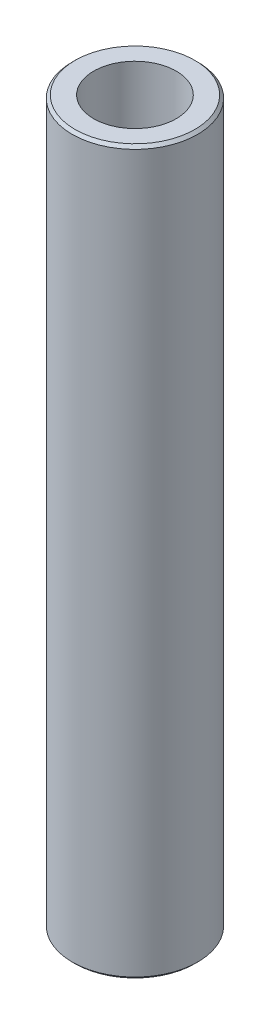
from build123d import *

# Parameters (mm, degrees)
SKETCH1_R           = 15
BOSS_EXTRUDE1_DEPTH = 172.743536967
SKETCH2_R           = 9.87025809
CUT_EXTRUDE1_DEPTH  = 175.041172037
CHAMFER1_SIZE       = 0.676382154


with BuildPart() as part:
    # Sketch1 → Boss-Extrude1 (new body)
    with BuildSketch(Plane(origin=(0, 0, 0), x_dir=(1, 0, 0), z_dir=(0, 1, 0))):
        Circle(SKETCH1_R)
    extrude(amount=BOSS_EXTRUDE1_DEPTH)

    # Sketch2 → Cut-Extrude1 (cut, through all)
    with BuildSketch(Plane(origin=(0, 0, 0), x_dir=(1, 0, 0), z_dir=(0, 1, 0))):
        Circle(SKETCH2_R)
    extrude(amount=CUT_EXTRUDE1_DEPTH, mode=Mode.SUBTRACT)

    # Chamfer1
    chamfer1_edges = [part.edges().sort_by_distance(p)[0] for p in [
        (-15, 172.743536967, 0),
        (-15, 0, 0),
    ]]
    chamfer(chamfer1_edges, length=CHAMFER1_SIZE)


solid = part.part
